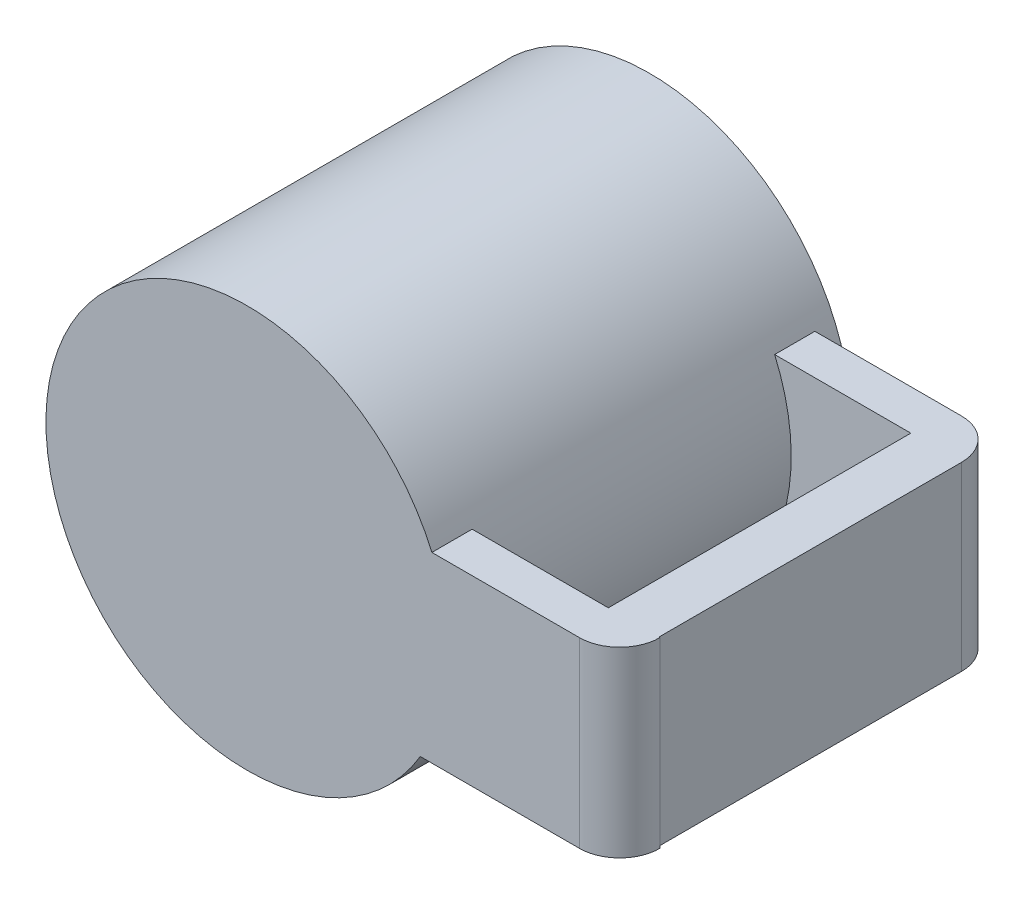
from build123d import *

# Parameters (mm, degrees)
SKETCH_1_R      = 5
EXTRUDE_1_DEPTH = 10
SKETCH_9_W      = 7.120641766
SKETCH_9_H      = 4.534999238
EXTRUDE_6_DEPTH = 1
SKETCH_11_W     = 1.257653538
SKETCH_11_H     = 9
EXTRUDE_7_DEPTH = 4.5
EXTRUDE_8_DEPTH = 6
FILLET_8_R      = 1
FILLET_9_R      = 1


with BuildPart() as part:
    # 草圖1 → 填料-伸長1 (new body)
    with BuildSketch(Plane(origin=(0.382706605, 0, 0), x_dir=(1, 0, 0), z_dir=(0, 0, 1))):
        with Locations((-75.594417438, 2.55)):
            Circle(SKETCH_1_R)
    extrude(amount=EXTRUDE_1_DEPTH)

    # 草圖9 → 填料-伸長6 (add)
    with BuildSketch(Plane(origin=(6.127831546, 0, 9), x_dir=(1, 0, 0), z_dir=(0, 0, 1))):
        with Locations((-75.644850643, 2.267499619)):
            Rectangle(SKETCH_9_W, SKETCH_9_H)
    extrude(amount=EXTRUDE_6_DEPTH)



with BuildPart() as body_2:
    # 草圖11 → 填料-伸長7 (new body)
    with BuildSketch(Plane(origin=(9.574526933, 4.534999238, 0.48426017), x_dir=(1, 0, 0), z_dir=(0, 1, 0))):
        with Locations((-76.184774061, -4.5)):
            Rectangle(SKETCH_11_W, SKETCH_11_H)
    extrude(amount=-EXTRUDE_7_DEPTH)


with BuildPart() as part_1:
    add(part.part)

    add(body_2.part)  # 填料-伸長8 merges body 2
    # 草圖12 → 填料-伸長8 (add)
    with BuildSketch(Plane.ZY.offset(67.239073897)):
        Polygon((0.48426017, 4.534999238), (0.48426017, 0), (1.483647509, 0.034999238), (1.483647509, 4.534999238), align=None)
    extrude(amount=EXTRUDE_8_DEPTH)

    # 圓角8
    fillet_8_edges = [part_1.edges().sort_by_distance(p)[0] for p in [
        (-65.981420359, 2.284999238, 0.48426017),
    ]]
    fillet(fillet_8_edges, radius=FILLET_8_R)

    # 圓角9
    fillet_9_edges = [part_1.edges().sort_by_distance(p)[0] for p in [
        (-65.956698214, 2.267499619, 10),
    ]]
    fillet(fillet_9_edges, radius=FILLET_9_R - 0.0001)  # a hair under: the kernel refuses the full size


solid = part_1.part
